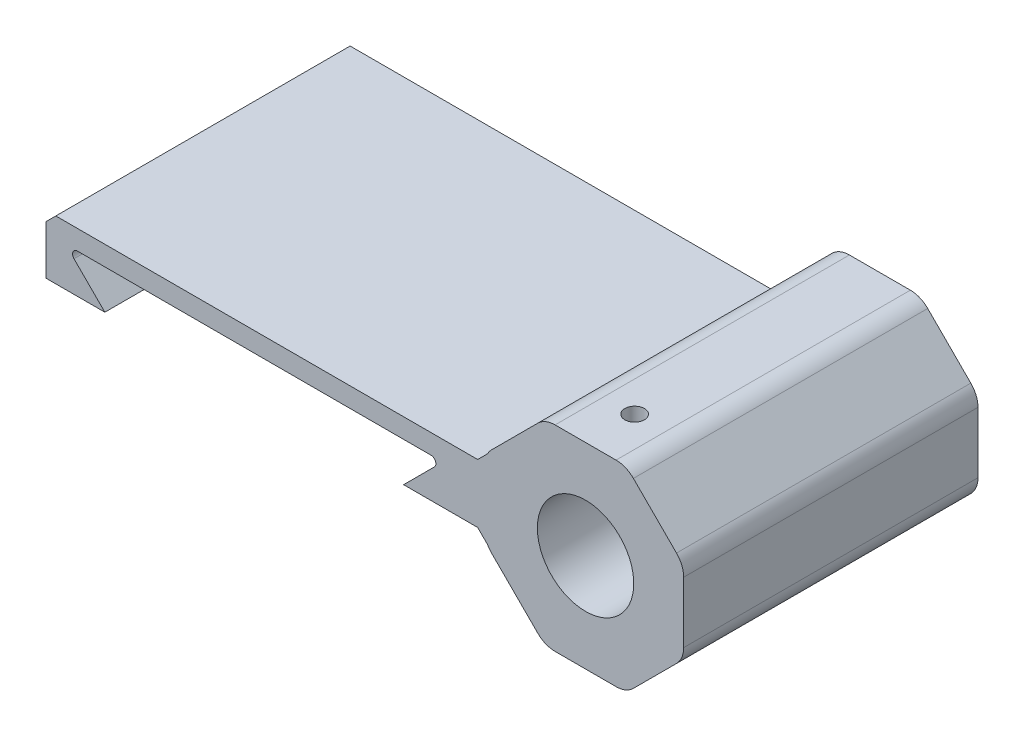
from build123d import *

# Parameters (mm, degrees)
SKETCH_1_W               = 90
SKETCH_1_H               = 12
EXTRUDE_1_DEPTH          = 60
CUT_EXTRUDE_1_DEPTH      = 60
SKETCH_3_R               = 9.825
EXTRUDE_2_DEPTH          = 60
CHAMFER_1_SIZE           = 2
FILLET_1_R               = 1
CHAMFER_3_SIZE           = 2
FILLET_2_R               = 5
CUT_EXTRUDE_2_REACH      = 113.467
CUT_EXTRUDE_2_END_RADIUS = 9.825
SKETCH_4_R               = 2


with BuildPart() as part:
    # Эскиз1 → Бобышка-Вытянуть1 (new body)
    with BuildSketch(Plane.XY):
        Rectangle(SKETCH_1_W, SKETCH_1_H)
    extrude(amount=EXTRUDE_1_DEPTH)

    # Эскиз2 → Вырез-Вытянуть1 (cut)
    with BuildSketch(Plane.XY.offset(60)):
        Polygon((-41, 2), (-33, -6), (27.9, -6), (35.9, 2), align=None)
    extrude(amount=-CUT_EXTRUDE_1_DEPTH, mode=Mode.SUBTRACT)

    # Эскиз3 → Бобышка-Вытянуть2 (add)
    with BuildSketch(Plane(origin=(0, 0, 0), x_dir=(-1, 0, 0), z_dir=(0, 0, -1))):
        Polygon((-73.284271247, -20), (-56.715728753, -20), (-45, -8.284271247), (-45, 8.284271247), (-56.715728753, 20), (-73.284271247, 20), (-85, 8.284271247), (-85, -8.284271247), align=None)
        with Locations((-65, 0)):
            Circle(SKETCH_3_R, mode=Mode.SUBTRACT)
    extrude(amount=-EXTRUDE_2_DEPTH)

    # Фаска1
    chamfer_1_edges = [part.edges().sort_by_distance(p)[0] for p in [
        (-45, 6, 30),
    ]]
    chamfer(chamfer_1_edges, length=CHAMFER_1_SIZE)

    # Скругление1
    fillet_1_edges = [part.edges().sort_by_distance(p)[0] for p in [
        (35.9, 2, 30),
        (-41, 2, 30),
    ]]
    fillet(fillet_1_edges, radius=FILLET_1_R)

    # Фаска3
    chamfer_3_edges = [part.edges().sort_by_distance(p)[0] for p in [
        (45, -6, 30),
        (45, 6, 30),
    ]]
    chamfer(chamfer_3_edges, length=CHAMFER_3_SIZE)

    # Скругление2
    # the kernel refuses this fillet: 5 mm, written as the material it takes off along each edge
    with BuildSketch(Plane(origin=(45, -8.284271247, -3.006121321), x_dir=(0.7071067811865452, -0.7071067811865497, 0), z_dir=(0, 0, 1))) as fillet_2_piece_1:
        with BuildLine():
            CenterArc((1.202448528, 5), FILLET_2_R, 253.698506294, 16.301493706)
            Line((-0.201010127, 0.201010127), (-0.2290793, 0.105030329))
            ThreePointArc((-0.2290793, 0.105030329), (-0.171215742, 0.029794385), (-0.070710678, -0.070710678))
            Line((-0.070710678, -0.070710678), (0, -0.1))
            Line((0, -0.1), (1.202448528, -0.1))
            Line((1.202448528, -0.1), (1.202448528, 0))
        make_face()
    extrude(amount=66.012242642, mode=Mode.SUBTRACT)
    with BuildSketch(Plane(origin=(56.715728753, -20, -5.17766953), x_dir=(1, 0, 0), z_dir=(0, 0, 1)), Plane(origin=(73.284271247, -20, -5.17766953), x_dir=(0.7071067811865485, 0.7071067811865467, 0), z_dir=(0, 0, 1)), Plane(origin=(85, -8.284271247, -5.17766953), x_dir=(0, 1, 0), z_dir=(0, 0, 1)), Plane(origin=(85, 8.284271247, -5.17766953), x_dir=(-0.7071067811865461, 0.7071067811865487, 0), z_dir=(0, 0, 1)), Plane(origin=(73.284271247, 20, -5.17766953), x_dir=(-1, 0, 0), z_dir=(0, 0, 1)), Plane(origin=(56.715728753, 20, -5.17766953), x_dir=(-0.7071067811865467, -0.7071067811865483, 0), z_dir=(0, 0, 1))) as fillet_2_piece_2:
        with BuildLine():
            CenterArc((FILLET_2_R * 0.414213562373, FILLET_2_R), FILLET_2_R, 225, 45)
            Line((-FILLET_2_R * 0.292893218813, FILLET_2_R * 0.292893218813), (-FILLET_2_R * 0.307035354437, FILLET_2_R * 0.27875108319))
            Line((-FILLET_2_R * 0.307035354437, FILLET_2_R * 0.27875108319), (-FILLET_2_R * 0.00828427124746, -FILLET_2_R * 0.02))
            Line((-FILLET_2_R * 0.00828427124746, -FILLET_2_R * 0.02), (FILLET_2_R * 0.414213562373, -FILLET_2_R * 0.02))
            Line((FILLET_2_R * 0.414213562373, -FILLET_2_R * 0.02), (FILLET_2_R * 0.414213562373, 0))
        make_face()
    extrude(amount=70.355339059, mode=Mode.SUBTRACT)
    with BuildSketch(Plane(origin=(45, 8.284271247, -3.006121321), x_dir=(0, -1, 0), z_dir=(0, 0, 1))) as fillet_2_piece_3:
        with BuildLine():
            CenterArc((2.685274397, 4.385793414), FILLET_2_R, 225, 16.301493706)
            Line((-0.850259508, 0.850259508), (-0.920970187, 0.77954883))
            Line((-0.920970187, 0.77954883), (-0.070710678, -0.070710678))
            Line((-0.070710678, -0.070710678), (0, -0.1))
            ThreePointArc((0, -0.1), (0.142135624, -0.1), (0.236251184, -0.087715868))
            Line((0.236251184, -0.087715868), (0.284271247, 0))
        make_face()
    extrude(amount=66.012242642, mode=Mode.SUBTRACT)

    # Вырез-Вытянуть2: up to this cylinder (the profile starts outside it)
    cut_extrude_2_end = Plane(origin=(65, 0, 50), z_dir=(0, 0, -1)) * Cylinder(CUT_EXTRUDE_2_END_RADIUS, 247.584, mode=Mode.PRIVATE)
    # Эскиз4 → Вырез-Вытянуть2 (cut, up to the surface)
    with BuildSketch(Plane(origin=(0, 20, 0), x_dir=(1, 0, 0), z_dir=(0, 1, 0)), mode=Mode.PRIVATE) as cut_extrude_2_sk1:
        with Locations(Location((65, -50, 0), (0, 0, 270))):
            Circle(SKETCH_4_R)
    cut_extrude_2_tool1 = extrude(cut_extrude_2_sk1.sketch, amount=-CUT_EXTRUDE_2_REACH, mode=Mode.PRIVATE) - cut_extrude_2_end
    add(cut_extrude_2_tool1.solids().sort_by_distance((65, 20, 50))[0], mode=Mode.SUBTRACT)


solid = part.part
